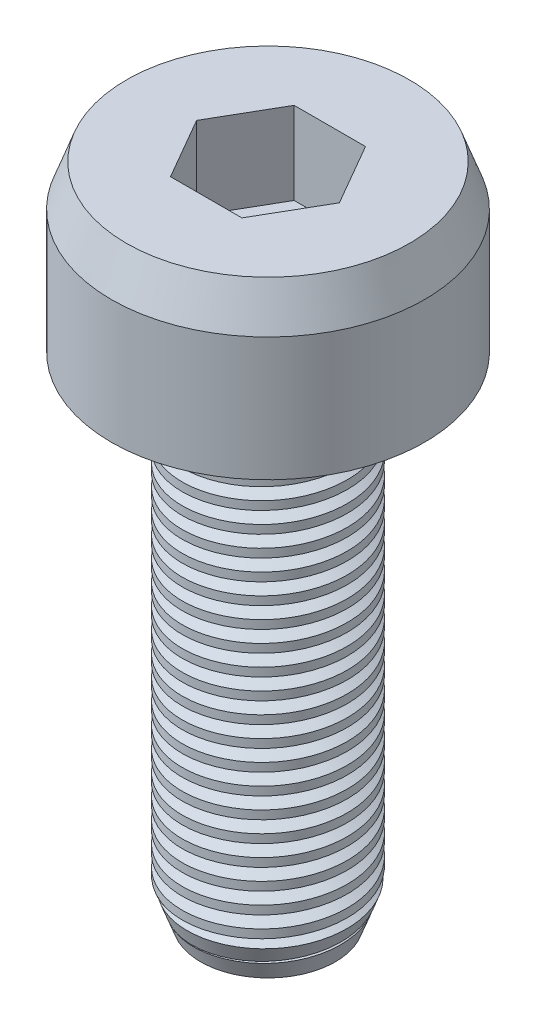
from build123d import *

# Parameters (mm, degrees)
SKETCH3_R           = 1.9
BOSS_EXTRUDE3_DEPTH = 1.5
SKETCH4_R           = 1.9
BOSS_EXTRUDE5_DEPTH = 0.5
BOSS_EXTRUDE5_TAPER = 20
CUT_EXTRUDE1_DEPTH  = 1
SKETCH7_R           = 1
BOSS_EXTRUDE6_DEPTH = 5.5
SKETCH8_R           = 1
BOSS_EXTRUDE7_DEPTH = 0.5
BOSS_EXTRUDE7_TAPER = 20
CUT_SWEEP1_PITCH    = 0.25
CUT_SWEEP1_TO       = 6


with BuildPart() as part:
    # Sketch3 → Boss-Extrude3 (new body)
    with BuildSketch(Plane(origin=(0, 0, 0), x_dir=(1, 0, 0), z_dir=(0, 1, 0))):
        with Locations(Location((0, 0, 0), (0, 0, 270))):
            Circle(SKETCH3_R)
    extrude(amount=BOSS_EXTRUDE3_DEPTH)

    # Sketch4 → Boss-Extrude5 (add)
    with BuildSketch(Plane(origin=(0, 1.5, 0), x_dir=(1, 0, 0), z_dir=(0, 1, 0))):
        with Locations(Location((0, 0, 0), (0, 0, 270))):
            Circle(SKETCH4_R)
    extrude(amount=BOSS_EXTRUDE5_DEPTH, taper=BOSS_EXTRUDE5_TAPER)

    # Sketch6 → Cut-Extrude1 (cut)
    with BuildSketch(Plane(origin=(0, 2, 0), x_dir=(1, 0, 0), z_dir=(0, 1, 0))):
        Polygon((0.866025404, 0), (0.433012702, 0.75), (-0.433012702, 0.75), (-0.866025404, 0), (-0.433012702, -0.75), (0.433012702, -0.75), align=None)
    extrude(amount=-CUT_EXTRUDE1_DEPTH, mode=Mode.SUBTRACT)

    # Sketch7 → Boss-Extrude6 (add)
    with BuildSketch(Plane.XZ):
        with Locations(Location((0, 0, 0), (0, 0, 90))):
            Circle(SKETCH7_R)
    extrude(amount=BOSS_EXTRUDE6_DEPTH)

    # Sketch8 → Boss-Extrude7 (add)
    with BuildSketch(Plane.XZ.offset(5.5)):
        with Locations(Location((0, 0, 0), (0, 0, 90))):
            Circle(SKETCH8_R)
    extrude(amount=BOSS_EXTRUDE7_DEPTH, taper=BOSS_EXTRUDE7_TAPER)

    # Cut-Sweep1: arcs per turn and ends read off the stored shape
    # Cut-Sweep1: the profile of Sketch10 screwed along a right-hand helix through 24.666667 turns, 6 arcs to a turn; built about Z, then put on its axis
    cut_sweep1_z = Axis((0, 0, 0), (0, 0, 1))
    cut_sweep1_corners = [(1.06350853, 0, -0.11), (0.872982941, 0, 0), (1.06350853, 0, 0.11)]
    with BuildLine(mode=Mode.PRIVATE) as cut_sweep1_profile:
        Line(cut_sweep1_corners[0], cut_sweep1_corners[1])
        Line(cut_sweep1_corners[1], cut_sweep1_corners[2])
        Line(cut_sweep1_corners[2], cut_sweep1_corners[0])
    cut_sweep1_cap = Face(cut_sweep1_profile.wire())
    cut_sweep1_turn_angles = [0, 30, 60, 90, 120, 150, 180, 210, 240, 270, 300, 330, 360]
    cut_sweep1_turn_weights = [1, 0.8660254037844387, 1, 0.8660254037844387, 1, 0.8660254037844387, 1, 0.8660254037844387, 1, 0.8660254037844387, 1, 0.8660254037844387, 1]
    cut_sweep1_turn_rails = [Edge.make_bspline([Vector(p[0], p[1], 0).rotate(cut_sweep1_z, cut_sweep1_turn_angles[k]) / cut_sweep1_turn_weights[k] + Vector(0, 0, p[2] + CUT_SWEEP1_PITCH * cut_sweep1_turn_angles[k] / 360) for k in range(13)], [0, 0, 0, 1, 1, 2, 2, 3, 3, 4, 4, 5, 5, 6, 6, 6], 2, cut_sweep1_turn_weights) for p in cut_sweep1_corners]
    cut_sweep1_turn_sides = [Face.make_surface_from_curves(cut_sweep1_turn_rails[p[0]], cut_sweep1_turn_rails[p[1]]) for p in [(0, 1), (1, 2), (2, 0)]]
    cut_sweep1_last_angles = [8640, 8670, 8700, 8730, 8760, 8790, 8820, 8850, 8880]
    cut_sweep1_last_weights = [1, 0.8660254037844387, 1, 0.8660254037844387, 1, 0.8660254037844387, 1, 0.8660254037844387, 1]
    cut_sweep1_last_rails = [Edge.make_bspline([Vector(p[0], p[1], 0).rotate(cut_sweep1_z, cut_sweep1_last_angles[k]) / cut_sweep1_last_weights[k] + Vector(0, 0, p[2] + CUT_SWEEP1_PITCH * cut_sweep1_last_angles[k] / 360) for k in range(9)], [0, 0, 0, 1, 1, 2, 2, 3, 3, 4, 4, 4], 2, cut_sweep1_last_weights) for p in cut_sweep1_corners]
    cut_sweep1_last_sides = [Face.make_surface_from_curves(cut_sweep1_last_rails[p[0]], cut_sweep1_last_rails[p[1]]) for p in [(0, 1), (1, 2), (2, 0)]]
    cut_sweep1 = Plane(origin=(0, -6, 0), x_dir=(1, 0, 0), z_dir=(0, 1, 0)) * split(Solid(Shell([*[p.moved(Location((0, 0, CUT_SWEEP1_PITCH * i))) for i in range(24) for p in cut_sweep1_turn_sides], *cut_sweep1_last_sides, cut_sweep1_cap, cut_sweep1_cap.rotate(cut_sweep1_z, 8880).moved(Location((0, 0, CUT_SWEEP1_PITCH * 8880 / 360)))])), bisect_by=Plane.XY.offset(CUT_SWEEP1_TO), keep=Keep.BOTTOM, mode=Mode.PRIVATE)
    add(cut_sweep1, mode=Mode.SUBTRACT)


solid = part.part
